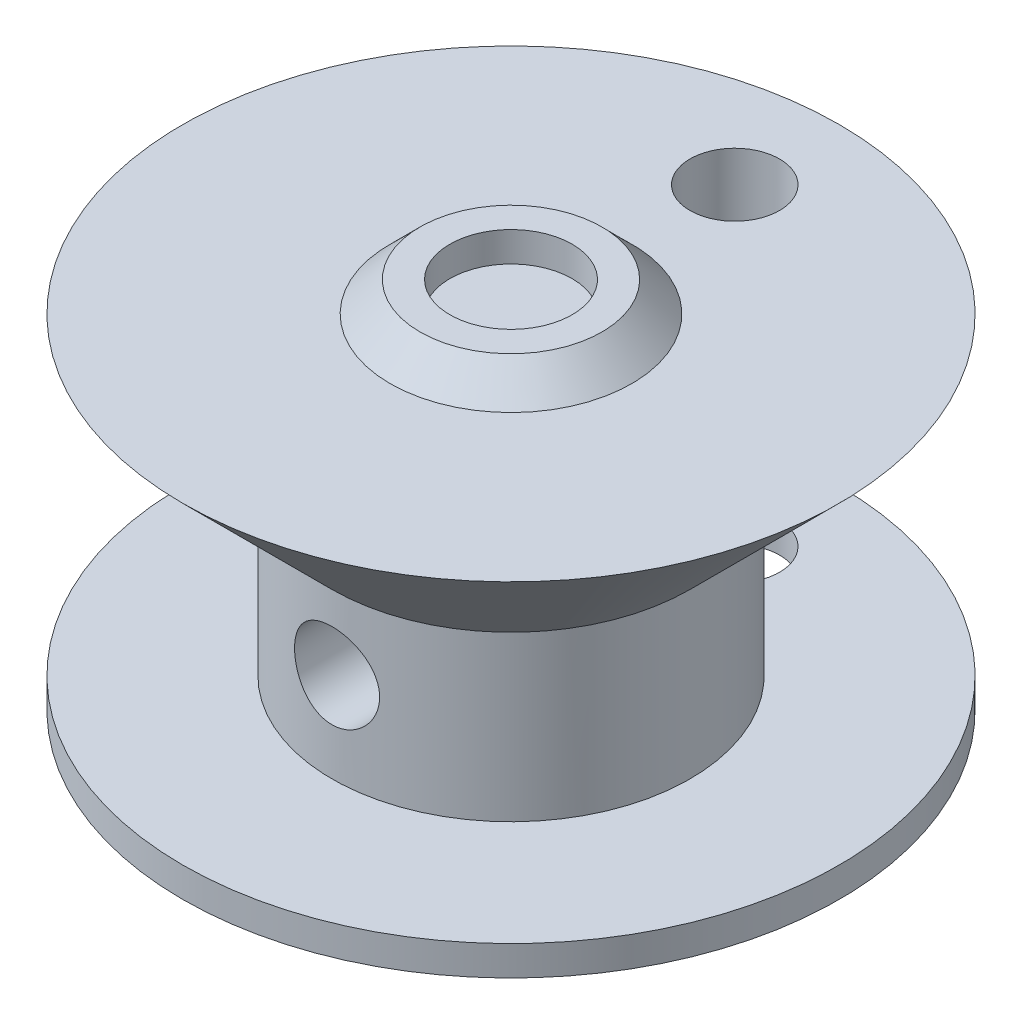
from build123d import *

# Parameters (mm, degrees)
FLATSPOT_EXTRUDE_REACH     = 21.956
WIRE_HOLE_CUT_DEPTH        = 20.345542122
WIRE_HOLE_CUT_DEPTH_BACK   = 20.345542122
SKETCH5_R                  = 1.5
SKETCH6_R                  = 1.425
SET_SCREW_CUT_DEPTH        = 19.1400801
MAGNET_START               = -1
SKETCH8_R                  = 11
SKETCH8_R_2                = 3.05
MAGNET_HOLDER_TRIM_DEPTH   = 1
MAGNET_HOLDER_CHAMFER_SIZE = 1
AXLE_TOLERANCE_CUT_DEPTH   = 8


with BuildPart() as part:
    # Sketch1 → Spool Solid (revolve)
    with BuildSketch(Plane(origin=(0, 0, 0), x_dir=(0, 0, -1), z_dir=(1, 0, 0)), mode=Mode.PRIVATE) as spool_solid_sk:
        Polygon((-11, 6.25), (-11, 5.25), (-6, 0.25), (-6, -5.25), (-11, -5.25), (-11, -6.25), (-2.5, -6.25), (-2.5, 1.75), (0, 4.25), (0, 5.25), (-2.05, 5.25), (-2.05, 6.25), (-2.5, 6.25), align=None)
    revolve(spool_solid_sk.sketch.rotate(Axis((0, 0, 0), (0, 1, 0)), 180), axis=Axis((0, 0, 0), (0, 1, 0)))

    # Flatspot Extrude: up to this cone (the profile starts inside it)
    flatspot_extrude_end = Plane(origin=(0, -6.25, 0), z_dir=(0, -1, 0)).offset(-10.499999) * Cone(1e-06, 43.456, 43.455999, align=(Align.CENTER, Align.CENTER, Align.MIN), mode=Mode.PRIVATE)
    # Sketch2 → Flatspot Extrude (add, up to the surface)
    with BuildSketch(Plane.XZ.offset(6.25), mode=Mode.PRIVATE) as flatspot_extrude_sk1:
        with BuildLine():
            Line((1.5, 2), (-1.5, 2))
            ThreePointArc((-1.5, 2), (0, 2.5), (1.5, 2))
        make_face()
    flatspot_extrude_tool1 = extrude(flatspot_extrude_sk1.sketch, amount=-FLATSPOT_EXTRUDE_REACH, mode=Mode.PRIVATE) & flatspot_extrude_end
    add(flatspot_extrude_tool1.solids().sort_by_distance((0, -6.25, 2.20182))[0])

    # Sketch5 → Wire Hole cut (cut, two sides: drawn at the far end of the back side and taken through both)
    with BuildSketch(Plane(origin=(0, -5.25, 0), x_dir=(1, 0, 0), z_dir=(0, 1, 0)).offset(-WIRE_HOLE_CUT_DEPTH_BACK)):
        with Locations(Location((0, 7.5, 0), (0, 0, 270))):
            Circle(SKETCH5_R)
    extrude(amount=WIRE_HOLE_CUT_DEPTH + WIRE_HOLE_CUT_DEPTH_BACK, mode=Mode.SUBTRACT)

    # Sketch6 → Set Screw Cut (cut, through all)
    with BuildSketch(Plane(origin=(0, 0, 2), x_dir=(-1, 0, 0), z_dir=(0, 0, -1))):
        with Locations((0, -2.25)):
            Circle(SKETCH6_R)
    extrude(amount=-SET_SCREW_CUT_DEPTH, mode=Mode.SUBTRACT)

    # Sketch8 → Magnet Holder Trim (cut)
    with BuildSketch(Plane(origin=(0, 6.25, 0), x_dir=(1, 0, 0), z_dir=(0, 1, 0)).offset(MAGNET_START)):
        with Locations(Location((0, 0, 0), (0, 0, 90))):
            Circle(SKETCH8_R)
        with Locations(Location((0, 0, 0), (0, 0, 270))):
            Circle(SKETCH8_R_2, mode=Mode.SUBTRACT)
    extrude(amount=MAGNET_HOLDER_TRIM_DEPTH, mode=Mode.SUBTRACT)

    # Magnet Holder Chamfer
    magnet_holder_chamfer_edges = [part.edges().sort_by_distance(p)[0] for p in [
        (0, 5.25, -3.05),
    ]]
    chamfer(magnet_holder_chamfer_edges, length=MAGNET_HOLDER_CHAMFER_SIZE - 0.0001)  # a hair under: the kernel refuses the full size

    # Sketch9 → Axle Tolerance Cut (cut)
    with BuildSketch(Plane.XZ.offset(6.25)):
        with BuildLine():
            Line((1.565247584, 2.2), (-1.565247584, 2.2))
            ThreePointArc((-1.565247584, 2.2), (0, -2.7), (1.565247584, 2.2))
        make_face()
    extrude(amount=-AXLE_TOLERANCE_CUT_DEPTH, mode=Mode.SUBTRACT)


solid = part.part
